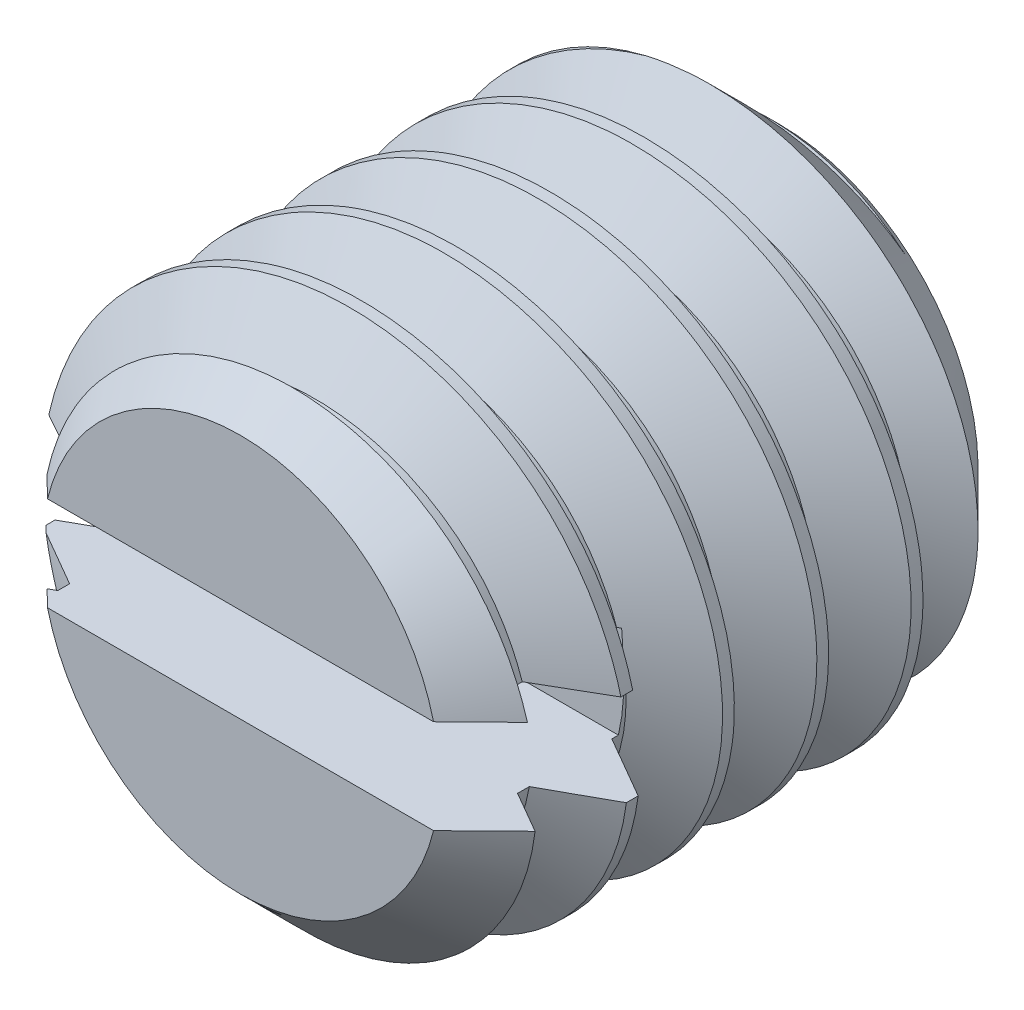
from build123d import *

# Parameters (mm, degrees)
CUT_EXTRUDE1_DEPTH      = 4.464101615
CUT_EXTRUDE1_DEPTH_BACK = 4.464101615
SKETCH3_W               = 1.3
SKETCH3_H               = 0.7
CUT_SWEEP1_PITCH        = 0.7


with BuildPart() as part:
    # Sketch2 → Revolve1 (revolve)
    with BuildSketch(Plane(origin=(0, 0, 0), x_dir=(0, 0, -1), z_dir=(1, 0, 0))):
        Polygon((-2, 0), (-2, 1.475), (-1.475, 2), (1.475, 2), (2, 1.475), (2, 0), align=None)
    revolve(axis=Axis((0, 0, -2), (0, 0, 1)))

    # Sketch3 → Cut-Extrude1 (cut, two sides: drawn at the far end of the back side and taken through both)
    with BuildSketch(Plane(origin=(0, 0, 0), x_dir=(0, 0, -1), z_dir=(1, 0, 0)).offset(-CUT_EXTRUDE1_DEPTH_BACK)):
        with Locations((-1.35, 0)):
            Rectangle(SKETCH3_W, SKETCH3_H)
    extrude(amount=CUT_EXTRUDE1_DEPTH + CUT_EXTRUDE1_DEPTH_BACK, mode=Mode.SUBTRACT)

    # Cut-Sweep1: the profile of Sketch5 screwed along a right-hand helix of 6.714286 turns, 6 arcs to a turn; built about Z, then put on its axis
    cut_sweep1_z = Axis((0, 0, 0), (0, 0, 1))
    cut_sweep1_corners = [(2.037888611, 0, -0.634375), (2.037888611, 0, 0.021875), (1.545336663, 0, -0.2625), (1.545336663, 0, -0.35)]
    with BuildLine(mode=Mode.PRIVATE) as cut_sweep1_profile:
        Line(cut_sweep1_corners[0], cut_sweep1_corners[1])
        Line(cut_sweep1_corners[1], cut_sweep1_corners[2])
        Line(cut_sweep1_corners[2], cut_sweep1_corners[3])
        Line(cut_sweep1_corners[3], cut_sweep1_corners[0])
    cut_sweep1_cap = Face(cut_sweep1_profile.wire())
    cut_sweep1_turn_angles = [0, 30, 60, 90, 120, 150, 180, 210, 240, 270, 300, 330, 360]
    cut_sweep1_turn_weights = [1, 0.8660254037844387, 1, 0.8660254037844387, 1, 0.8660254037844387, 1, 0.8660254037844387, 1, 0.8660254037844387, 1, 0.8660254037844387, 1]
    cut_sweep1_turn_rails = [Edge.make_bspline([Vector(p[0], p[1], 0).rotate(cut_sweep1_z, cut_sweep1_turn_angles[k]) / cut_sweep1_turn_weights[k] + Vector(0, 0, p[2] + CUT_SWEEP1_PITCH * cut_sweep1_turn_angles[k] / 360) for k in range(13)], [0, 0, 0, 1, 1, 2, 2, 3, 3, 4, 4, 5, 5, 6, 6, 6], 2, cut_sweep1_turn_weights) for p in cut_sweep1_corners]
    cut_sweep1_turn_sides = [Face.make_surface_from_curves(cut_sweep1_turn_rails[p[0]], cut_sweep1_turn_rails[p[1]]) for p in [(0, 1), (1, 2), (2, 3), (3, 0)]]
    cut_sweep1_last_angles = [2160, 2190, 2220, 2250, 2280, 2310, 2340, 2370, 2400, 2408.571428571, 2417.142857143]
    cut_sweep1_last_weights = [1, 0.8660254037844387, 1, 0.8660254037844387, 1, 0.8660254037844387, 1, 0.8660254037844387, 1, 0.9888308262251253, 1]
    cut_sweep1_last_rails = [Edge.make_bspline([Vector(p[0], p[1], 0).rotate(cut_sweep1_z, cut_sweep1_last_angles[k]) / cut_sweep1_last_weights[k] + Vector(0, 0, p[2] + CUT_SWEEP1_PITCH * cut_sweep1_last_angles[k] / 360) for k in range(11)], [0, 0, 0, 1, 1, 2, 2, 3, 3, 4, 4, 5, 5, 5], 2, cut_sweep1_last_weights) for p in cut_sweep1_corners]
    cut_sweep1_last_sides = [Face.make_surface_from_curves(cut_sweep1_last_rails[p[0]], cut_sweep1_last_rails[p[1]]) for p in [(0, 1), (1, 2), (2, 3), (3, 0)]]
    cut_sweep1 = Plane(origin=(0, 0, 2), x_dir=(0, 1, 0), z_dir=(0, 0, -1)) * Solid(Shell([*[p.moved(Location((0, 0, CUT_SWEEP1_PITCH * i))) for i in range(6) for p in cut_sweep1_turn_sides], *cut_sweep1_last_sides, cut_sweep1_cap, cut_sweep1_cap.rotate(cut_sweep1_z, 2417.142857143).moved(Location((0, 0, CUT_SWEEP1_PITCH * 2417.142857143 / 360)))]))
    add(cut_sweep1, mode=Mode.SUBTRACT)


solid = part.part
